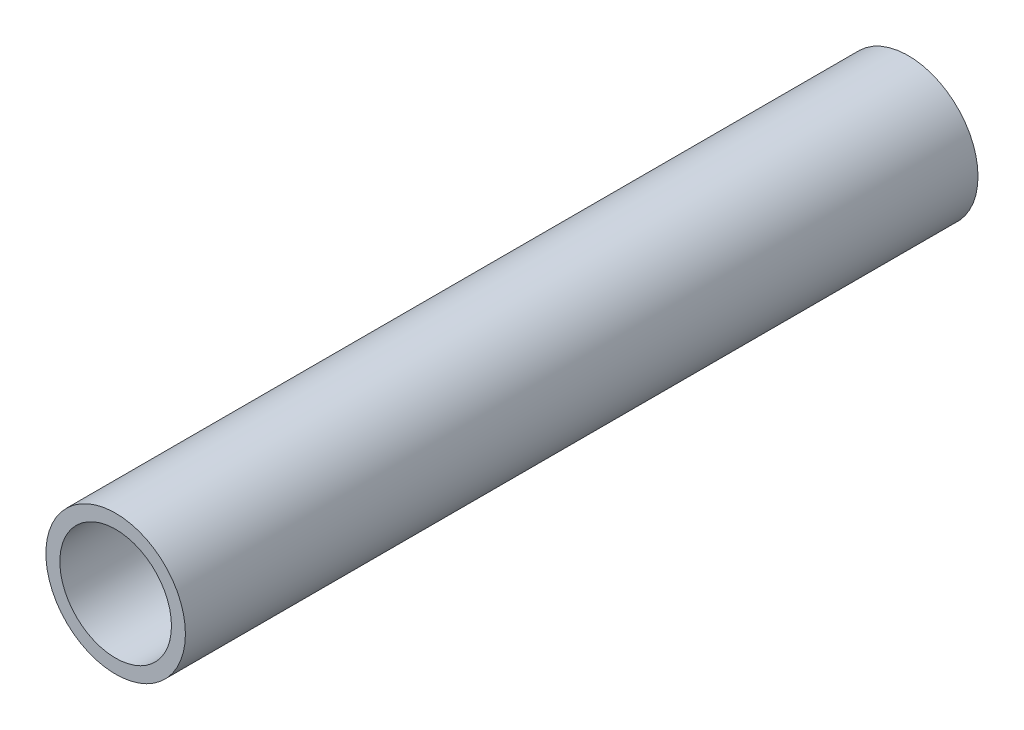
from build123d import *

# Parameters (mm, degrees)
SKETCH1_R           = 1.25
SKETCH1_R_2         = 1
BOSS_EXTRUDE1_DEPTH = 14.2


with BuildPart() as part:
    # Sketch1 → Boss-Extrude1 (new body)
    with BuildSketch(Plane.XY):
        Circle(SKETCH1_R)
        Circle(SKETCH1_R_2, mode=Mode.SUBTRACT)
    extrude(amount=BOSS_EXTRUDE1_DEPTH)


solid = part.part
